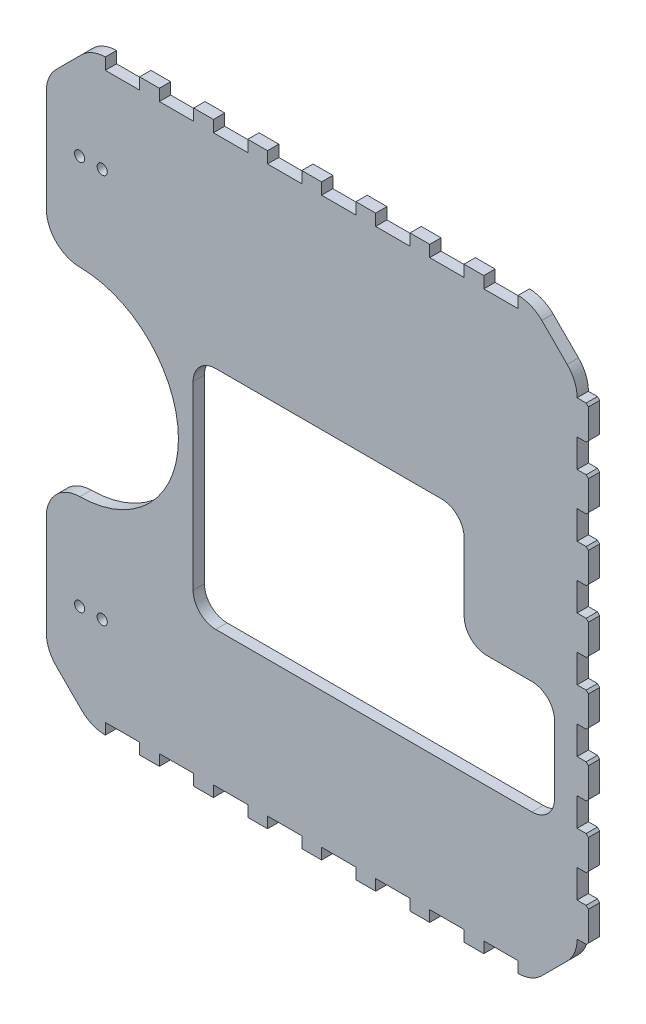
from build123d import *

# Parameters (mm, degrees)
ESQUISSE1_W                            = 235
ESQUISSE1_H                            = 260
BOSS_EXTRU_1_DEPTH                     = 5
ENL_V_MAT_EXTRU_1_DEPTH                = 351.499643366
CHANFREIN1_SIZE                        = 20
CONG_1_R                               = 15
CHANFREIN2_SIZE                        = 20
CONG_2_R                               = 15
ENL_V_MAT_EXTRU_2_DEPTH                = 351.499643366
CHANFREIN3_SIZE                        = 20
CHANFREIN4_SIZE                        = 20
CONG_3_R                               = 15
TENON_ET_MORTAISE_TENON1_DEPTH         = 5
TENON_START                            = -208.886796564
TENON_ET_MORTAISE_RAINURE1_OUTLINE_W   = 4.9
TENON_ET_MORTAISE_RAINURE1_OUTLINE_H   = 4.9
TENON_ET_MORTAISE_RAINURE1_DEPTH       = 15.2
TENON_START_2                          = -184.947711832
TENON_ET_MORTAISE_RAINURE1_2_OUTLINE_W = 4.9
TENON_ET_MORTAISE_RAINURE1_2_OUTLINE_H = 4.9
TENON_ET_MORTAISE_RAINURE1_2_DEPTH     = 15.2
TENON_START_3                          = -161.008627099
TENON_ET_MORTAISE_RAINURE1_3_OUTLINE_W = 4.9
TENON_ET_MORTAISE_RAINURE1_3_OUTLINE_H = 4.9
TENON_ET_MORTAISE_RAINURE1_3_DEPTH     = 15.2
TENON_START_4                          = -137.069542366
TENON_ET_MORTAISE_RAINURE1_4_OUTLINE_W = 4.9
TENON_ET_MORTAISE_RAINURE1_4_OUTLINE_H = 4.9
TENON_ET_MORTAISE_RAINURE1_4_DEPTH     = 15.2
TENON_START_5                          = -113.130457634
TENON_ET_MORTAISE_RAINURE1_5_OUTLINE_W = 4.9
TENON_ET_MORTAISE_RAINURE1_5_OUTLINE_H = 4.9
TENON_ET_MORTAISE_RAINURE1_5_DEPTH     = 15.2
TENON_START_6                          = -89.191372901
TENON_ET_MORTAISE_RAINURE1_6_OUTLINE_W = 4.9
TENON_ET_MORTAISE_RAINURE1_6_OUTLINE_H = 4.9
TENON_ET_MORTAISE_RAINURE1_6_DEPTH     = 15.2
TENON_START_7                          = -65.252288168
TENON_ET_MORTAISE_RAINURE1_7_OUTLINE_W = 4.9
TENON_ET_MORTAISE_RAINURE1_7_OUTLINE_H = 4.9
TENON_ET_MORTAISE_RAINURE1_7_DEPTH     = 15.2
TENON_START_8                          = -41.313203436
TENON_ET_MORTAISE_RAINURE1_8_OUTLINE_W = 4.9
TENON_ET_MORTAISE_RAINURE1_8_OUTLINE_H = 4.9
TENON_ET_MORTAISE_RAINURE1_8_DEPTH     = 15.2
TENON_ET_MORTAISE_RAINURE3_OUTLINE_W   = 5.1
TENON_ET_MORTAISE_RAINURE3_OUTLINE_H   = 5
TENON_ET_MORTAISE_RAINURE3_DEPTH       = 15.2
TENON_ET_MORTAISE_RAINURE3_2_OUTLINE_W = 5.1
TENON_ET_MORTAISE_RAINURE3_2_OUTLINE_H = 5
TENON_ET_MORTAISE_RAINURE3_2_DEPTH     = 15.2
TENON_ET_MORTAISE_RAINURE3_3_OUTLINE_W = 5.1
TENON_ET_MORTAISE_RAINURE3_3_OUTLINE_H = 5
TENON_ET_MORTAISE_RAINURE3_3_DEPTH     = 15.2
TENON_ET_MORTAISE_RAINURE3_4_OUTLINE_W = 5.1
TENON_ET_MORTAISE_RAINURE3_4_OUTLINE_H = 5
TENON_ET_MORTAISE_RAINURE3_4_DEPTH     = 15.2
TENON_ET_MORTAISE_RAINURE3_5_OUTLINE_W = 5.1
TENON_ET_MORTAISE_RAINURE3_5_OUTLINE_H = 5
TENON_ET_MORTAISE_RAINURE3_5_DEPTH     = 15.2
TENON_ET_MORTAISE_RAINURE3_6_OUTLINE_W = 5.1
TENON_ET_MORTAISE_RAINURE3_6_OUTLINE_H = 5
TENON_ET_MORTAISE_RAINURE3_6_DEPTH     = 15.2
TENON_ET_MORTAISE_RAINURE3_7_OUTLINE_W = 5.1
TENON_ET_MORTAISE_RAINURE3_7_OUTLINE_H = 5
TENON_ET_MORTAISE_RAINURE3_7_DEPTH     = 15.2
TENON_ET_MORTAISE_RAINURE3_8_OUTLINE_W = 5.1
TENON_ET_MORTAISE_RAINURE3_8_OUTLINE_H = 5
TENON_ET_MORTAISE_RAINURE3_8_DEPTH     = 15.2
ESQUISSE5_R                            = 2.25
ENL_V_MAT_EXTRU_3_DEPTH                = 351.499643366


# Read off the part's stored shape, not the designer's step: Tenon et mortaise-Tenon1, Tenon et mortaise-Rainure1, Tenon et mortaise-Rainure3
with BuildPart() as part:
    # Esquisse1 → Boss.-Extru.1 (new body)
    with BuildSketch(Plane.XY):
        with Locations((-117.5, -130)):
            Rectangle(ESQUISSE1_W, ESQUISSE1_H)
    extrude(amount=BOSS_EXTRU_1_DEPTH)

    # Esquisse2 → Enlèv. mat.-Extru.1 (cut, through all)
    with BuildSketch(Plane.XY.offset(5)):
        with BuildLine():
            Line((-235, -88.657244293), (-235, -171.741538838))
            ThreePointArc((-235, -171.741538838), (-176.5, -130.199391565), (-235, -88.657244293))
        make_face()
    extrude(amount=-ENL_V_MAT_EXTRU_1_DEPTH, mode=Mode.SUBTRACT)

    # Chanfrein1
    chanfrein1_edges = [part.edges().sort_by_distance(p)[0] for p in [
        (-235, -260, 2.5),
    ]]
    chamfer(chanfrein1_edges, length=CHANFREIN1_SIZE)

    # Congé1
    cong_1_edges = [part.edges().sort_by_distance(p)[0] for p in [
        (-215, -260, 2.5),
        (-235, -240, 2.5),
    ]]
    fillet(cong_1_edges, radius=CONG_1_R)

    # Chanfrein2
    chanfrein2_edges = [part.edges().sort_by_distance(p)[0] for p in [
        (-235, 0, 2.5),
    ]]
    chamfer(chanfrein2_edges, length=CHANFREIN2_SIZE)

    # Congé2
    cong_2_edges = [part.edges().sort_by_distance(p)[0] for p in [
        (-235, -20, 2.5),
        (-215, 0, 2.5),
    ]]
    fillet(cong_2_edges, radius=CONG_2_R)

    # Esquisse4 → Enlèv. mat.-Extru.2 (cut, through all)
    with BuildSketch(Plane(origin=(0, 0, 0), x_dir=(-1, 0, 0), z_dir=(0, 0, -1))):
        with BuildLine():
            Line((20, -195), (160, -195))
            ThreePointArc((160, -195), (167.071067812, -192.071067812), (170, -185))
            Line((170, -185), (170, -105))
            ThreePointArc((170, -105), (167.071067812, -97.928932188), (160, -95))
            Line((160, -95), (60, -95))
            ThreePointArc((60, -95), (52.928932188, -97.928932188), (50, -105))
            Line((50, -105), (50, -135))
            ThreePointArc((50, -135), (47.071067812, -142.071067812), (40, -145))
            Line((40, -145), (20, -145))
            ThreePointArc((20, -145), (12.928932188, -147.928932188), (10, -155))
            Line((10, -155), (10, -185))
            ThreePointArc((10, -185), (12.928932188, -192.071067812), (20, -195))
        make_face()
    extrude(amount=-ENL_V_MAT_EXTRU_2_DEPTH, mode=Mode.SUBTRACT)

    # Chanfrein3
    chanfrein3_edges = [part.edges().sort_by_distance(p)[0] for p in [
        (0, -260, 2.5),
    ]]
    chamfer(chanfrein3_edges, length=CHANFREIN3_SIZE)

    # Chanfrein4
    chanfrein4_edges = [part.edges().sort_by_distance(p)[0] for p in [
        (0, 0, 2.5),
    ]]
    chamfer(chanfrein4_edges, length=CHANFREIN4_SIZE)

    # Congé3
    cong_3_edges = [part.edges().sort_by_distance(p)[0] for p in [
        (0, -240, 2.5),
        (-20, -260, 2.5),
        (-20, 0, 2.5),
        (0, -20, 2.5),
        (-235, -171.741538838, 2.5),
        (-235, -88.657244293, 2.5),
    ]]
    fillet(cong_3_edges, radius=CONG_3_R)

    # Tenon et mortaise-Tenon1 outline → Tenon et mortaise-Tenon1 (add)
    with BuildSketch(Plane.XY):
        Polygon((4, -218.786796564), (0, -218.786796564), (0, -233.786796564), (4, -233.786796564), (5, -232.786796564), (5, -219.786796564), align=None)
        Polygon((4, -191.27628326), (0, -191.27628326), (0, -206.27628326), (4, -206.27628326), (5, -205.27628326), (5, -192.27628326), align=None)
        Polygon((4, -163.765769956), (0, -163.765769956), (0, -178.765769956), (4, -178.765769956), (5, -177.765769956), (5, -164.765769956), align=None)
        Polygon((4, -136.255256652), (0, -136.255256652), (0, -151.255256652), (4, -151.255256652), (5, -150.255256652), (5, -137.255256652), align=None)
        Polygon((4, -108.744743348), (0, -108.744743348), (0, -123.744743348), (4, -123.744743348), (5, -122.744743348), (5, -109.744743348), align=None)
        Polygon((4, -81.234230044), (0, -81.234230044), (0, -96.234230044), (4, -96.234230044), (5, -95.234230044), (5, -82.234230044), align=None)
        Polygon((4, -53.72371674), (0, -53.72371674), (0, -68.72371674), (4, -68.72371674), (5, -67.72371674), (5, -54.72371674), align=None)
        Polygon((0, -41.213203436), (4, -41.213203436), (5, -40.213203436), (5, -27.213203436), (4, -26.213203436), (0, -26.213203436), align=None)
    extrude(amount=TENON_ET_MORTAISE_TENON1_DEPTH)

    # Tenon et mortaise-Rainure1 outline → Tenon et mortaise-Rainure1 (cut)
    with BuildSketch(Plane.YZ.offset(TENON_START)):
        with Locations((-257.55, 2.55)):
            Rectangle(TENON_ET_MORTAISE_RAINURE1_OUTLINE_W, TENON_ET_MORTAISE_RAINURE1_OUTLINE_H)
    extrude(amount=TENON_ET_MORTAISE_RAINURE1_DEPTH, mode=Mode.SUBTRACT)

    # Tenon et mortaise-Rainure1 2 outline → Tenon et mortaise-Rainure1 2 (cut)
    with BuildSketch(Plane.YZ.offset(TENON_START_2)):
        with Locations((-257.55, 2.55)):
            Rectangle(TENON_ET_MORTAISE_RAINURE1_2_OUTLINE_W, TENON_ET_MORTAISE_RAINURE1_2_OUTLINE_H)
    extrude(amount=TENON_ET_MORTAISE_RAINURE1_2_DEPTH, mode=Mode.SUBTRACT)

    # Tenon et mortaise-Rainure1 3 outline → Tenon et mortaise-Rainure1 3 (cut)
    with BuildSketch(Plane.YZ.offset(TENON_START_3)):
        with Locations((-257.55, 2.55)):
            Rectangle(TENON_ET_MORTAISE_RAINURE1_3_OUTLINE_W, TENON_ET_MORTAISE_RAINURE1_3_OUTLINE_H)
    extrude(amount=TENON_ET_MORTAISE_RAINURE1_3_DEPTH, mode=Mode.SUBTRACT)

    # Tenon et mortaise-Rainure1 4 outline → Tenon et mortaise-Rainure1 4 (cut)
    with BuildSketch(Plane.YZ.offset(TENON_START_4)):
        with Locations((-257.55, 2.55)):
            Rectangle(TENON_ET_MORTAISE_RAINURE1_4_OUTLINE_W, TENON_ET_MORTAISE_RAINURE1_4_OUTLINE_H)
    extrude(amount=TENON_ET_MORTAISE_RAINURE1_4_DEPTH, mode=Mode.SUBTRACT)

    # Tenon et mortaise-Rainure1 5 outline → Tenon et mortaise-Rainure1 5 (cut)
    with BuildSketch(Plane.YZ.offset(TENON_START_5)):
        with Locations((-257.55, 2.55)):
            Rectangle(TENON_ET_MORTAISE_RAINURE1_5_OUTLINE_W, TENON_ET_MORTAISE_RAINURE1_5_OUTLINE_H)
    extrude(amount=TENON_ET_MORTAISE_RAINURE1_5_DEPTH, mode=Mode.SUBTRACT)

    # Tenon et mortaise-Rainure1 6 outline → Tenon et mortaise-Rainure1 6 (cut)
    with BuildSketch(Plane.YZ.offset(TENON_START_6)):
        with Locations((-257.55, 2.55)):
            Rectangle(TENON_ET_MORTAISE_RAINURE1_6_OUTLINE_W, TENON_ET_MORTAISE_RAINURE1_6_OUTLINE_H)
    extrude(amount=TENON_ET_MORTAISE_RAINURE1_6_DEPTH, mode=Mode.SUBTRACT)

    # Tenon et mortaise-Rainure1 7 outline → Tenon et mortaise-Rainure1 7 (cut)
    with BuildSketch(Plane.YZ.offset(TENON_START_7)):
        with Locations((-257.55, 2.55)):
            Rectangle(TENON_ET_MORTAISE_RAINURE1_7_OUTLINE_W, TENON_ET_MORTAISE_RAINURE1_7_OUTLINE_H)
    extrude(amount=TENON_ET_MORTAISE_RAINURE1_7_DEPTH, mode=Mode.SUBTRACT)

    # Tenon et mortaise-Rainure1 8 outline → Tenon et mortaise-Rainure1 8 (cut)
    with BuildSketch(Plane.YZ.offset(TENON_START_8)):
        with Locations((-257.55, 2.55)):
            Rectangle(TENON_ET_MORTAISE_RAINURE1_8_OUTLINE_W, TENON_ET_MORTAISE_RAINURE1_8_OUTLINE_H)
    extrude(amount=TENON_ET_MORTAISE_RAINURE1_8_DEPTH, mode=Mode.SUBTRACT)

    # Tenon et mortaise-Rainure3 outline → Tenon et mortaise-Rainure3 (cut)
    with BuildSketch(Plane.YZ.offset(TENON_START)):
        with Locations((-2.55, 2.5)):
            Rectangle(TENON_ET_MORTAISE_RAINURE3_OUTLINE_W, TENON_ET_MORTAISE_RAINURE3_OUTLINE_H)
    extrude(amount=TENON_ET_MORTAISE_RAINURE3_DEPTH, mode=Mode.SUBTRACT)

    # Tenon et mortaise-Rainure3 2 outline → Tenon et mortaise-Rainure3 2 (cut)
    with BuildSketch(Plane.YZ.offset(TENON_START_2)):
        with Locations((-2.55, 2.5)):
            Rectangle(TENON_ET_MORTAISE_RAINURE3_2_OUTLINE_W, TENON_ET_MORTAISE_RAINURE3_2_OUTLINE_H)
    extrude(amount=TENON_ET_MORTAISE_RAINURE3_2_DEPTH, mode=Mode.SUBTRACT)

    # Tenon et mortaise-Rainure3 3 outline → Tenon et mortaise-Rainure3 3 (cut)
    with BuildSketch(Plane.YZ.offset(TENON_START_3)):
        with Locations((-2.55, 2.5)):
            Rectangle(TENON_ET_MORTAISE_RAINURE3_3_OUTLINE_W, TENON_ET_MORTAISE_RAINURE3_3_OUTLINE_H)
    extrude(amount=TENON_ET_MORTAISE_RAINURE3_3_DEPTH, mode=Mode.SUBTRACT)

    # Tenon et mortaise-Rainure3 4 outline → Tenon et mortaise-Rainure3 4 (cut)
    with BuildSketch(Plane.YZ.offset(TENON_START_4)):
        with Locations((-2.55, 2.5)):
            Rectangle(TENON_ET_MORTAISE_RAINURE3_4_OUTLINE_W, TENON_ET_MORTAISE_RAINURE3_4_OUTLINE_H)
    extrude(amount=TENON_ET_MORTAISE_RAINURE3_4_DEPTH, mode=Mode.SUBTRACT)

    # Tenon et mortaise-Rainure3 5 outline → Tenon et mortaise-Rainure3 5 (cut)
    with BuildSketch(Plane.YZ.offset(TENON_START_5)):
        with Locations((-2.55, 2.5)):
            Rectangle(TENON_ET_MORTAISE_RAINURE3_5_OUTLINE_W, TENON_ET_MORTAISE_RAINURE3_5_OUTLINE_H)
    extrude(amount=TENON_ET_MORTAISE_RAINURE3_5_DEPTH, mode=Mode.SUBTRACT)

    # Tenon et mortaise-Rainure3 6 outline → Tenon et mortaise-Rainure3 6 (cut)
    with BuildSketch(Plane.YZ.offset(TENON_START_6)):
        with Locations((-2.55, 2.5)):
            Rectangle(TENON_ET_MORTAISE_RAINURE3_6_OUTLINE_W, TENON_ET_MORTAISE_RAINURE3_6_OUTLINE_H)
    extrude(amount=TENON_ET_MORTAISE_RAINURE3_6_DEPTH, mode=Mode.SUBTRACT)

    # Tenon et mortaise-Rainure3 7 outline → Tenon et mortaise-Rainure3 7 (cut)
    with BuildSketch(Plane.YZ.offset(TENON_START_7)):
        with Locations((-2.55, 2.5)):
            Rectangle(TENON_ET_MORTAISE_RAINURE3_7_OUTLINE_W, TENON_ET_MORTAISE_RAINURE3_7_OUTLINE_H)
    extrude(amount=TENON_ET_MORTAISE_RAINURE3_7_DEPTH, mode=Mode.SUBTRACT)

    # Tenon et mortaise-Rainure3 8 outline → Tenon et mortaise-Rainure3 8 (cut)
    with BuildSketch(Plane.YZ.offset(TENON_START_8)):
        with Locations((-2.55, 2.5)):
            Rectangle(TENON_ET_MORTAISE_RAINURE3_8_OUTLINE_W, TENON_ET_MORTAISE_RAINURE3_8_OUTLINE_H)
    extrude(amount=TENON_ET_MORTAISE_RAINURE3_8_DEPTH, mode=Mode.SUBTRACT)

    # Esquisse5 → Enlèv. mat.-Extru.3 (cut, through all)
    with BuildSketch(Plane(origin=(0, 0, 0), x_dir=(-1, 0, 0), z_dir=(0, 0, -1))):
        with Locations((210.25, -43.7)):
            Circle(ESQUISSE5_R)
        with Locations((220.25, -43.7)):
            Circle(ESQUISSE5_R)
    enl_v_mat_extru_3 = extrude(amount=-ENL_V_MAT_EXTRU_3_DEPTH, mode=Mode.SUBTRACT)

    # Symétrie1: Enlèv. mat.-Extru.3 across plane
    add(enl_v_mat_extru_3.mirror(Plane.ZX.offset(-130)), mode=Mode.SUBTRACT)


solid = part.part
